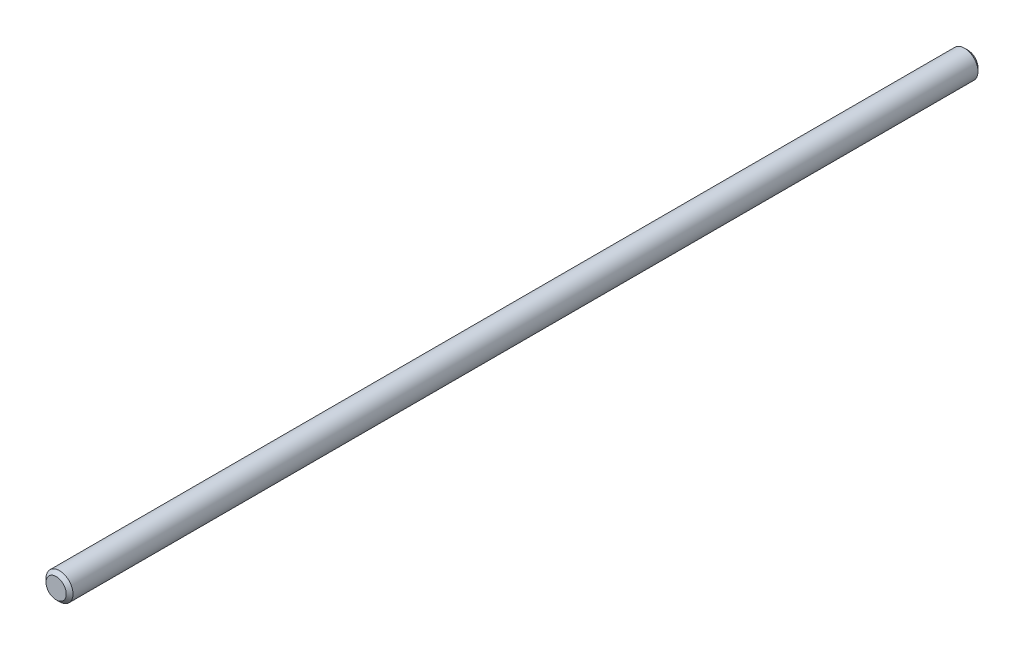
from build123d import *

# Parameters (mm, degrees)
SCHIZZO1_R                   = 4
ESTRUSIONE_ESTRUSIONE1_DEPTH = 270
SMUSSO1_SIZE                 = 1


with BuildPart() as part:
    # Schizzo1 → Estrusione-Estrusione1 (new body)
    with BuildSketch(Plane.XY):
        Circle(SCHIZZO1_R)
    extrude(amount=ESTRUSIONE_ESTRUSIONE1_DEPTH)

    # Smusso1
    smusso1_edges = [part.edges().sort_by_distance(p)[0] for p in [
        (-4, 0, 270),
        (-4, 0, 0),
    ]]
    chamfer(smusso1_edges, length=SMUSSO1_SIZE)


solid = part.part
